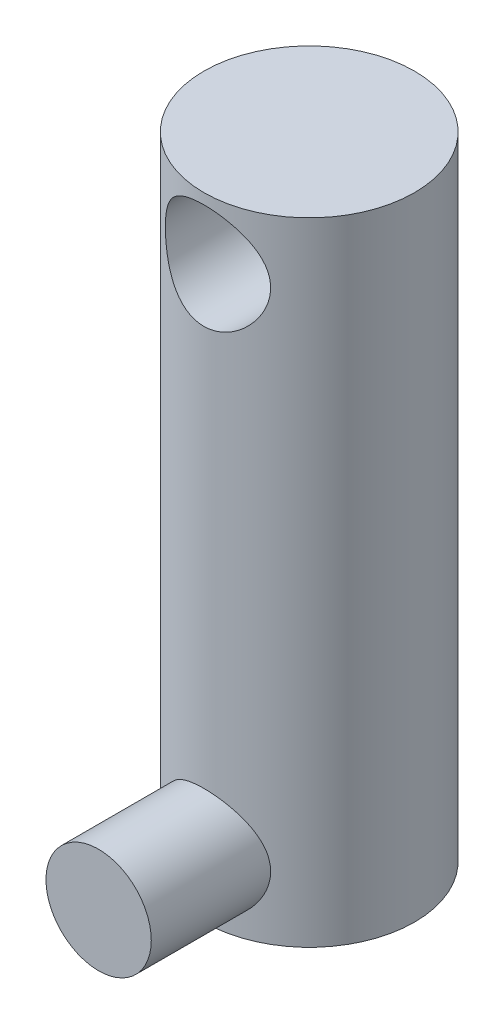
from build123d import *

# Parameters (mm, degrees)
SKETCH1_R                            = 5
BOSS_EXTRUDE1_DEPTH                  = 30
SKETCH2_R                            = 2.5
BOSS_EXTRUDE2_DEPTH                  = 5
BOSS_EXTRUDE2_DIRECTION_2_REACH      = 34.016
BOSS_EXTRUDE2_DIRECTION_2_END_RADIUS = 5
SKETCH3_R                            = 2.5
CUT_EXTRUDE1_DEPTH                   = 33.015621218


with BuildPart() as part:
    # Sketch1 → Boss-Extrude1 (new body)
    with BuildSketch(Plane(origin=(0, 0, 0), x_dir=(1, 0, 0), z_dir=(0, 1, 0))):
        Circle(SKETCH1_R)
    extrude(amount=BOSS_EXTRUDE1_DEPTH)

    # Sketch3 → Cut-Extrude1 (cut, through all)
    with BuildSketch(Plane.XY):
        with Locations((0, 27)):
            Circle(SKETCH3_R)
    extrude(amount=CUT_EXTRUDE1_DEPTH, mode=Mode.SUBTRACT)


with BuildPart() as body_2:
    # Sketch2 → Boss-Extrude2 (new body)
    with BuildSketch(Plane.XY.offset(5)):
        with Locations((0, 3)):
            Circle(SKETCH2_R)
    extrude(amount=BOSS_EXTRUDE2_DEPTH)

    # Boss-Extrude2 direction 2: up to this cylinder (the profile starts outside it)
    boss_extrude2_direction_2_end = Plane(origin=(0, 3, 0), z_dir=(0, -1, 0)) * Cylinder(BOSS_EXTRUDE2_DIRECTION_2_END_RADIUS, 79.032, mode=Mode.PRIVATE)
    # Sketch2 → Boss-Extrude2 direction 2 (add, up to the surface)
    with BuildSketch(Plane.XY.offset(5), mode=Mode.PRIVATE) as boss_extrude2_direction_2_sk1:
        with Locations((0, 3)):
            Circle(SKETCH2_R)
    boss_extrude2_direction_2_tool1 = extrude(boss_extrude2_direction_2_sk1.sketch, amount=-BOSS_EXTRUDE2_DIRECTION_2_REACH, mode=Mode.PRIVATE) - boss_extrude2_direction_2_end
    add(boss_extrude2_direction_2_tool1.solids().sort_by_distance((0, 3, 5))[0])
    add(boss_extrude2_direction_2_tool1.solids().sort_by_distance((0, 3, 5))[1])


solid = Compound([part.part, body_2.part])
